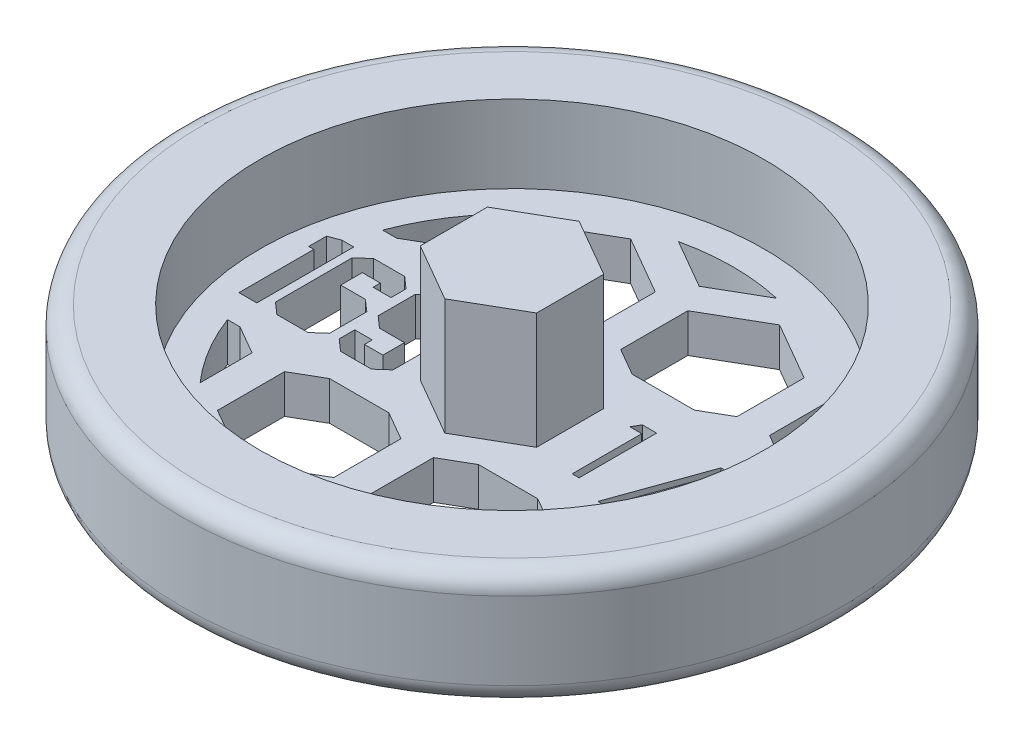
from build123d import *

# Parameters (mm, degrees)
BOSS_EXTRUDE1_DEPTH     = 9.525
CUT_EXTRUDE1_DEPTH      = 40.336699626
CUT_EXTRUDE1_DEPTH_BACK = 40.336699626
SKETCH3_W               = 1.512047341
SKETCH3_H               = 1.768047435
SKETCH3_W_2             = 1.470129197
CUT_EXTRUDE2_DEPTH      = 40.336699626
CUT_EXTRUDE2_DEPTH_BACK = 40.336699626


with BuildPart() as part:
    # Sketch1 → Revolve1 (revolve)
    with BuildSketch(Plane.XY):
        with BuildLine():
            Line((0, 0), (25.4, 0))
            ThreePointArc((25.4, 0), (26.522532015, 0.464967985), (26.9875, 1.5875))
            Line((26.9875, 1.5875), (26.9875, 7.9375))
            ThreePointArc((26.9875, 7.9375), (26.522532015, 9.060032015), (25.4, 9.525))
            Line((25.4, 9.525), (20.6375, 9.525))
            Line((20.6375, 9.525), (20.6375, 3.175))
            Line((20.6375, 3.175), (0, 3.175))
            Line((0, 3.175), (0, 0))
        make_face()
    revolve(axis=Axis((0, 3.175, 0), (0, -1, 0)))

    # Sketch2 → Boss-Extrude1 (add)
    with BuildSketch(Plane(origin=(0, 3.175, 0), x_dir=(1, 0, 0), z_dir=(0, 1, 0))):
        Polygon((0, 5.499261314), (-4.7625, 2.749630657), (-4.7625, -2.749630657), (0, -5.499261314), (4.7625, -2.749630657), (4.7625, 2.749630657), align=None)
    extrude(amount=BOSS_EXTRUDE1_DEPTH)

    # Sketch3 → Cut-Extrude1 (cut, two sides: drawn at the far end of the back side and taken through both)
    # profile 1 of 6: a face of its own
    with BuildSketch(Plane(origin=(0, 3.175, 0), x_dir=(1, 0, 0), z_dir=(0, 1, 0)).offset(-CUT_EXTRUDE1_DEPTH_BACK)):
        Polygon((-6.60689834, -3.139369578), (-7.545565353, -3.96875), (-10.072630611, -3.96875), (-11.0127947, -3.139369578), (-11.0127947, -1.862363259), (-9.583086571, -1.862363259), (-9.583086571, -2.503112033), (-8.07103923, -2.503112033), (-8.07103923, -0.735064598), (-10.117542908, -0.735064598), (-11.053215768, 0.094315824), (-11.053215768, 3.134878348), (-10.117542908, 3.96875), (-7.556044889, 3.96875), (-6.60689834, 3.130387118), align=None)
        with Locations((-8.8270629, 1.619088316)):
            Rectangle(SKETCH3_W, SKETCH3_H, mode=Mode.SUBTRACT)
    # profile 2 of 6: a face of its own
    with BuildSketch(Plane(origin=(0, 3.175, 0), x_dir=(1, 0, 0), z_dir=(0, 1, 0)).offset(-CUT_EXTRUDE1_DEPTH_BACK)):
        Polygon((-11.800256978, -3.139369578), (-12.740421068, -3.96875), (-15.286948321, -3.96875), (-16.22711241, -3.139369578), (-16.22711241, 3.134878348), (-15.297427857, 3.96875), (-12.755391833, 3.96875), (-11.815227744, 3.134878348), (-11.815227744, 1.907275556), (-13.285356941, 1.907275556), (-13.285356941, 2.503112033), (-14.761474444, 2.503112033), (-14.761474444, 0.735064598), (-12.740421068, 0.735064598), (-11.800256978, -0.088327518), align=None)
        with Locations((-14.026409846, -1.619088316)):
            Rectangle(SKETCH3_W_2, SKETCH3_H, mode=Mode.SUBTRACT)
    # profile 3 of 6: a face of its own
    with BuildSketch(Plane(origin=(0, 3.175, 0), x_dir=(1, 0, 0), z_dir=(0, 1, 0)).offset(-CUT_EXTRUDE1_DEPTH_BACK)):
        Polygon((-16.929241324, -3.96875), (-18.394879291, -3.96875), (-18.394879291, 2.164772727), (-18.814060732, 2.164772727), (-18.814060732, 3.630410694), (-17.909826481, 3.96875), (-16.929241324, 3.96875), align=None)
    # profile 4 of 6: a face of its own
    with BuildSketch(Plane(origin=(0, 3.175, 0), x_dir=(1, 0, 0), z_dir=(0, 1, 0)).offset(-CUT_EXTRUDE1_DEPTH_BACK)):
        Polygon((7.496103766, 3.175), (8.670192308, 3.175), (8.670192308, -3.175), (8.100320513, -3.175), (8.100320513, 2.523717949), (7.123397436, 2.523717949), align=None)
    # profile 5 of 6: a face of its own
    with BuildSketch(Plane(origin=(0, 3.175, 0), x_dir=(1, 0, 0), z_dir=(0, 1, 0)).offset(-CUT_EXTRUDE1_DEPTH_BACK)):
        Polygon((14.368910256, 3.337820513), (11.712900641, -4.070512821), (11.1125, -4.070512821), (13.768509615, 3.337820513), align=None)
    # profile 6 of 6: a face of its own
    with BuildSketch(Plane(origin=(0, 3.175, 0), x_dir=(1, 0, 0), z_dir=(0, 1, 0)).offset(-CUT_EXTRUDE1_DEPTH_BACK)):
        Polygon((18.323667869, 3.337820513), (18.439423077, 3.337820513), (18.439423077, -1.058333333), (19.172115385, -1.058333333), (19.172115385, -1.709615385), (18.439423077, -1.709615385), (18.439423077, -3.175), (17.869551282, -3.175), (17.869551282, -1.709615385), (14.857371795, -1.709615385), align=None)
        Polygon((17.869551282, -1.058333333), (17.869551282, 1.699439103), (15.976762821, -1.058333333), align=None, mode=Mode.SUBTRACT)
    extrude(amount=CUT_EXTRUDE1_DEPTH + CUT_EXTRUDE1_DEPTH_BACK, mode=Mode.SUBTRACT)


with BuildPart() as cut_extrude1_piece_1:
    # of the separate pieces the step leaves, piece 1, a body of its own (cut_extrude1_pieces_kept)
    add(part.part.solids().sort_by_distance((25.4, 0, 0))[0])

    # Sketch4 → Cut-Extrude2 (cut, two sides: drawn at the far end of the back side and taken through both)
    with BuildSketch(Plane(origin=(0, 3.175, 0), x_dir=(1, 0, 0), z_dir=(0, 1, 0)).offset(-CUT_EXTRUDE2_DEPTH_BACK)):
        Polygon((-1.397, -7.69896584), (-3.733477372, -6.35), (-8.585522628, -6.35), (-10.922, -7.69896584), (-10.922, -13.198227154), (-6.1595, -15.947857811), (-1.397, -13.198227154), align=None)
        Polygon((8.458522628, -6.35), (3.606477372, -6.35), (1.27, -7.69896584), (1.27, -13.198227154), (6.0325, -15.947857811), (10.795, -13.198227154), (10.795, -7.69896584), align=None)
        with BuildLine():
            Line((-13.589, -7.69896584), (-15.925477372, -6.35))
            Line((-15.925477372, -6.35), (-16.946887804, -6.35))
            ThreePointArc((-16.946887804, -6.35), (-15.522779467, -9.303914438), (-13.589, -11.952346433))
            Line((-13.589, -11.952346433), (-13.589, -7.69896584))
        make_face()
        with BuildLine():
            Line((16.946887804, -6.35), (15.798477372, -6.35))
            Line((15.798477372, -6.35), (13.462, -7.69896584))
            Line((13.462, -7.69896584), (13.462, -12.095208235))
            ThreePointArc((13.462, -12.095208235), (15.473427829, -9.385762487), (16.946887804, -6.35))
        make_face()
        Polygon((-8.705368408, 6.35), (-3.613631592, 6.35), (-1.397, 7.629772846), (-1.397, 13.12903416), (-6.1595, 15.878664817), (-10.922, 13.12903416), (-10.922, 7.629772846), align=None)
        Polygon((1.27, 7.629772846), (3.486631592, 6.35), (8.578368408, 6.35), (10.795, 7.629772846), (10.795, 13.12903416), (6.0325, 15.878664817), (1.27, 13.12903416), align=None)
        with BuildLine():
            Line((-16.946887804, 6.35), (-15.805631592, 6.35))
            Line((-15.805631592, 6.35), (-13.589, 7.629772846))
            Line((-13.589, 7.629772846), (-13.589, 11.952346433))
            ThreePointArc((-13.589, 11.952346433), (-15.522779467, 9.303914438), (-16.946887804, 6.35))
        make_face()
        with BuildLine():
            Line((13.462, 7.629772846), (15.678631592, 6.35))
            Line((15.678631592, 6.35), (16.946887804, 6.35))
            ThreePointArc((16.946887804, 6.35), (15.473427829, 9.385762487), (13.462, 12.095208235))
            Line((13.462, 12.095208235), (13.462, 7.629772846))
        make_face()
        with BuildLine():
            Line((0, -15.328738686), (-4.014638475, -17.64659129))
            ThreePointArc((-4.014638475, -17.64659129), (0, -18.0975), (4.014638475, -17.64659129))
            Line((4.014638475, -17.64659129), (0, -15.328738686))
        make_face()
        with BuildLine():
            ThreePointArc((4.014638475, 17.64659129), (0, 18.0975), (-4.014638475, 17.64659129))
            Line((-4.014638475, 17.64659129), (0, 15.328738686))
            Line((0, 15.328738686), (4.014638475, 17.64659129))
        make_face()
    extrude(amount=CUT_EXTRUDE2_DEPTH + CUT_EXTRUDE2_DEPTH_BACK, mode=Mode.SUBTRACT)


with BuildPart() as cut_extrude1_piece_2:
    # of the separate pieces the step leaves, piece 2, a body of its own (cut_extrude1_pieces_kept)
    add(part.part.solids().sort_by_distance((17.869551282, 0, 1.058333333))[0])


solid = Compound([cut_extrude1_piece_1.part, cut_extrude1_piece_2.part])
